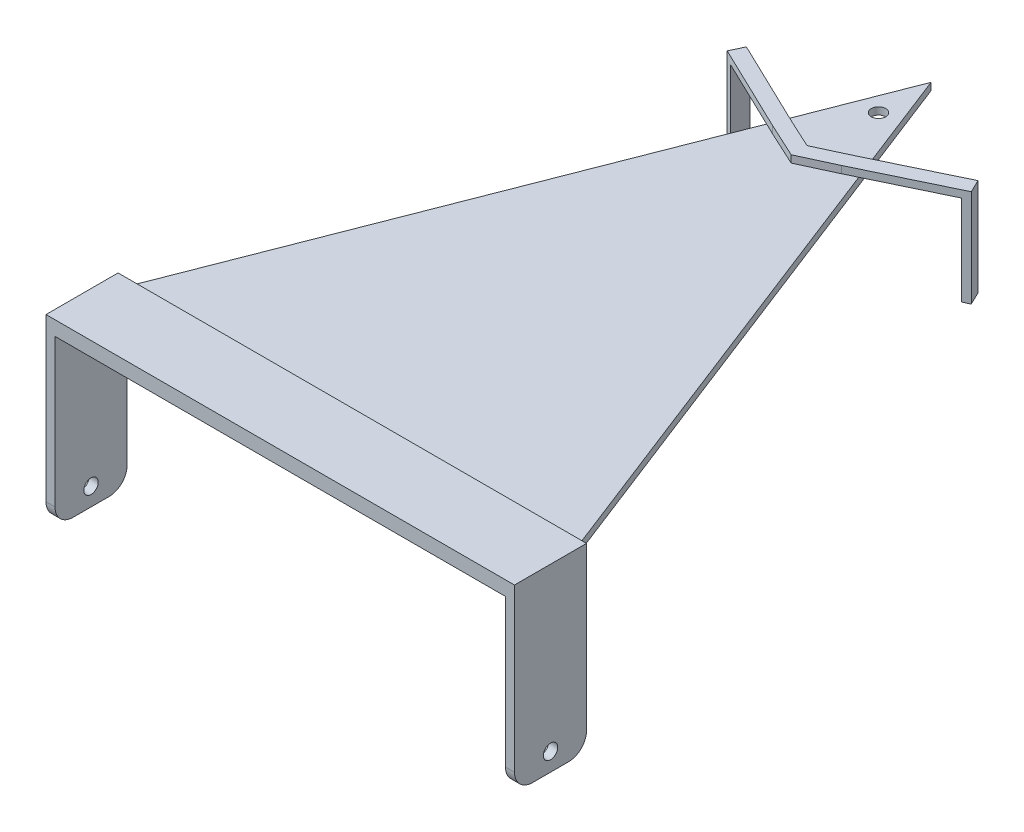
from build123d import *

# Parameters (mm, degrees)
SKETCH2_R           = 2
BOSS_EXTRUDE1_DEPTH = 2
SKETCH4_W           = 125
SKETCH4_H           = 20
BOSS_EXTRUDE4_DEPTH = 2
SKETCH7_W           = 2.5
SKETCH7_H           = 20
BOSS_EXTRUDE5_DEPTH = 50
FILLET1_R           = 5
SKETCH9_R           = 2
CUT_EXTRUDE1_DEPTH  = 250
BOSS_EXTRUDE6_DEPTH = 2
SKETCH11_W          = 4
SKETCH11_H          = 27
BOSS_EXTRUDE7_DEPTH = 2
SKETCH12_W          = 4
SKETCH12_H          = 27
BOSS_EXTRUDE8_DEPTH = 2


with BuildPart() as part:
    # Sketch2 → Boss-Extrude1 (new body)
    with BuildSketch(Plane(origin=(0, 0, 0), x_dir=(1, 0, 0), z_dir=(0, 1, 0))):
        Polygon((125, 0), (125, 10), (62.5, 170.616846689), (0, 10), (0, 0), (0, -10), (125, -10), align=None)
        with Locations((62.5, 156.024837766)):
            Circle(SKETCH2_R, mode=Mode.SUBTRACT)
    extrude(amount=BOSS_EXTRUDE1_DEPTH)

    # Sketch4 → Boss-Extrude4 (add)
    with BuildSketch(Plane(origin=(0, 2, 0), x_dir=(1, 0, 0), z_dir=(0, 1, 0))):
        with Locations((62.5, 0)):
            Rectangle(SKETCH4_W, SKETCH4_H)
    extrude(amount=BOSS_EXTRUDE4_DEPTH)

    # Sketch7 → Boss-Extrude5 (add)
    with BuildSketch(Plane(origin=(0, 4, 0), x_dir=(1, 0, 0), z_dir=(0, 1, 0))):
        with Locations((-1.25, 0)):
            Rectangle(SKETCH7_W, SKETCH7_H)
        with Locations((126.25, 0)):
            Rectangle(SKETCH7_W, SKETCH7_H)
    extrude(amount=-BOSS_EXTRUDE5_DEPTH)

    # Fillet1
    fillet1_edges = [part.edges().sort_by_distance(p)[0] for p in [
        (126.25, -46, 10),
        (126.25, -46, -10),
        (-1.25, -46, -10),
        (-1.25, -46, 10),
    ]]
    fillet(fillet1_edges, radius=FILLET1_R)

    # Sketch9 → Cut-Extrude1 (cut)
    with BuildSketch(Plane.ZY.offset(2.5)):
        with Locations((0, -41)):
            Circle(SKETCH9_R)
    extrude(amount=-CUT_EXTRUDE1_DEPTH, mode=Mode.SUBTRACT)

    # Sketch10 → Boss-Extrude6 (add)
    with BuildSketch(Plane(origin=(0, 2, 0), x_dir=(1, 0, 0), z_dir=(0, 1, 0))):
        Polygon((52.968755075, 136.196691858), (30.436771088, 147.027652), (32.16972471, 150.632769438), (54.701708698, 139.801809296), (62.5, 136.196691858), (70.298291302, 139.801809296), (92.83027529, 150.632769438), (94.563228912, 147.027652), (72.031244925, 136.196691858), (62.5, 131.790437211), align=None)
    extrude(amount=BOSS_EXTRUDE6_DEPTH)

    # Sketch11 → Boss-Extrude7 (add)
    with BuildSketch(Plane(origin=(134.223850515, 0, -64.52042465), x_dir=(-0.4332384056875235, 0, -0.90127935948702), z_dir=(0.90127935948702, 0, -0.4332384056875235))):
        with Locations((93.544565491, -9.5)):
            Rectangle(SKETCH11_W, SKETCH11_H)
    extrude(amount=BOSS_EXTRUDE7_DEPTH)

    # Sketch12 → Boss-Extrude8 (add)
    with BuildSketch(Plane(origin=(-32.685790035, 0, -15.711820552), x_dir=(-0.43323840568752436, 0, 0.9012793594870195), z_dir=(-0.9012793594870195, 0, -0.43323840568752436))):
        with Locations((-147.699366202, -9.5)):
            Rectangle(SKETCH12_W, SKETCH12_H)
    extrude(amount=BOSS_EXTRUDE8_DEPTH)


solid = part.part
